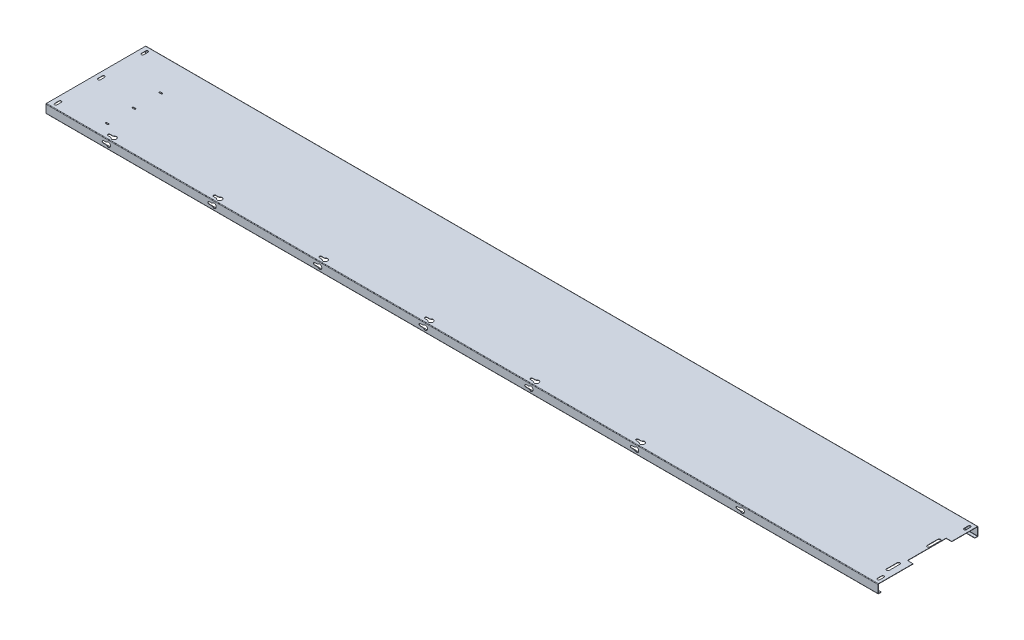
from build123d import *

# Parameters (mm, degrees)
SM_BASE_FLANGE_1_DEPTH = 3119
CUT_EXTRUDE_1_DEPTH    = 10
CUT_EXTRUDE_2_DEPTH    = 10
CUT_EXTRUDE_3_DEPTH    = 20
CUT_EXTRUDE_4_DEPTH    = 3140.834734504
CUT_EXTRUDE_6_DEPTH    = 3140.834734504
SKETCH_12_W            = 21
SKETCH_12_H            = 145
CUT_EXTRUDE_7_DEPTH    = 3140.834734504


# Sheet-metal steps are written as plain solids
with BuildPart() as part:
    # Sketch 1 → 基体-法兰1 (new body)
    with BuildSketch(Plane(origin=(0, 0, 0), x_dir=(0, 0, -1), z_dir=(1, 0, 0))):
        with BuildLine():
            Line((-3.4, -20.5), (-13.4634, -20.5))
            ThreePointArc((-13.4634, -20.5), (-14.832782992, -19.932782992), (-15.4, -18.5634))
            Line((-15.4, -18.5634), (-15.4, 10.5634))
            ThreePointArc((-15.4, 10.5634), (-14.832782992, 11.932782992), (-13.4634, 12.5))
            Line((-13.4634, 12.5), (357.6634, 12.5))
            ThreePointArc((357.6634, 12.5), (359.032782992, 11.932782992), (359.6, 10.5634))
            Line((359.6, 10.5634), (359.6, -18.5634))
            ThreePointArc((359.6, -18.5634), (359.032782992, -19.932782992), (357.6634, -20.5))
            Line((357.6634, -20.5), (347.6, -20.5))
            Line((347.6, -20.5), (347.6, -19.3))
            Line((347.6, -19.3), (357.6634, -19.3))
            ThreePointArc((357.6634, -19.3), (358.184254855, -19.084254855), (358.4, -18.5634))
            Line((358.4, -18.5634), (358.4, 10.5634))
            ThreePointArc((358.4, 10.5634), (358.184254855, 11.084254855), (357.6634, 11.3))
            Line((357.6634, 11.3), (-13.4634, 11.3))
            ThreePointArc((-13.4634, 11.3), (-13.984254855, 11.084254855), (-14.2, 10.5634))
            Line((-14.2, 10.5634), (-14.2, -18.5634))
            ThreePointArc((-14.2, -18.5634), (-13.984254855, -19.084254855), (-13.4634, -19.3))
            Line((-13.4634, -19.3), (-3.4, -19.3))
            Line((-3.4, -19.3), (-3.4, -20.5))
        make_face()
    extrude(amount=SM_BASE_FLANGE_1_DEPTH)

    # 草图6 → 切除-拉伸1 (cut)
    with BuildSketch(Plane(origin=(0, 12.5, 0), x_dir=(1, 0, 0), z_dir=(0, 1, 0))):
        with BuildLine():
            Line((3108.5, 180.1), (3108.5, 164.1))
            ThreePointArc((3108.5, 164.1), (3104, 159.6), (3099.5, 164.1))
            Line((3099.5, 164.1), (3099.5, 180.1))
            ThreePointArc((3099.5, 180.1), (3104, 184.6), (3108.5, 180.1))
        make_face()
        with BuildLine():
            Line((3108.5, 17.6), (3108.5, 1.6))
            ThreePointArc((3108.5, 1.6), (3104, -2.9), (3099.5, 1.6))
            Line((3099.5, 1.6), (3099.5, 17.6))
            ThreePointArc((3099.5, 17.6), (3104, 22.1), (3108.5, 17.6))
        make_face()
        with BuildLine():
            Line((3108.5, 342.6), (3108.5, 326.6))
            ThreePointArc((3108.5, 326.6), (3104, 322.1), (3099.5, 326.6))
            Line((3099.5, 326.6), (3099.5, 342.6))
            ThreePointArc((3099.5, 342.6), (3104, 347.1), (3108.5, 342.6))
        make_face()
        with BuildLine():
            Line((24.5, 17.6), (24.5, 1.6))
            ThreePointArc((24.5, 1.6), (20, -2.9), (15.5, 1.6))
            Line((15.5, 1.6), (15.5, 17.6))
            ThreePointArc((15.5, 17.6), (20, 22.1), (24.5, 17.6))
        make_face()
        with BuildLine():
            Line((24.5, 180.1), (24.5, 164.1))
            ThreePointArc((24.5, 164.1), (20, 159.6), (15.5, 164.1))
            Line((15.5, 164.1), (15.5, 180.1))
            ThreePointArc((15.5, 180.1), (20, 184.6), (24.5, 180.1))
        make_face()
        with BuildLine():
            Line((24.5, 342.6), (24.5, 326.6))
            ThreePointArc((24.5, 326.6), (20, 322.1), (15.5, 326.6))
            Line((15.5, 326.6), (15.5, 342.6))
            ThreePointArc((15.5, 342.6), (20, 347.1), (24.5, 342.6))
        make_face()
    extrude(amount=-CUT_EXTRUDE_1_DEPTH, mode=Mode.SUBTRACT)

    # 草图7 → 切除-拉伸2 (cut)
    with BuildSketch(Plane(origin=(0, 12.5, 0), x_dir=(1, 0, 0), z_dir=(0, 1, 0))):
        with BuildLine():
            Line((3096, 89.6), (3096, 49.6))
            ThreePointArc((3096, 49.6), (3091, 44.6), (3086, 49.6))
            Line((3086, 49.6), (3086, 89.6))
            ThreePointArc((3086, 89.6), (3091, 94.6), (3096, 89.6))
        make_face()
        with BuildLine():
            Line((3096, 242.1), (3096, 202.1))
            ThreePointArc((3096, 202.1), (3091, 197.1), (3086, 202.1))
            Line((3086, 202.1), (3086, 242.1))
            ThreePointArc((3086, 242.1), (3091, 247.1), (3096, 242.1))
        make_face()
    extrude(amount=-CUT_EXTRUDE_2_DEPTH, mode=Mode.SUBTRACT)

    # 草图8 → 切除-拉伸3 (cut)
    with BuildSketch(Plane.XY.offset(15.4)):
        with BuildLine():
            Line((215, -8.24999999), (225.066684168, -8.24999999))
            Line((225.066684168, -8.24999999), (233.286049958, -12.995453041))
            ThreePointArc((233.286049958, -12.995453041), (242, -3.999999989), (233.286049936, 4.995453042))
            Line((233.286049936, 4.995453042), (225.066684179, 0.25000001))
            Line((225.066684179, 0.25000001), (215, 0.25000001))
            ThreePointArc((215, 0.25000001), (210.75, -3.99999999), (215, -8.24999999))
        make_face()
        with BuildLine():
            Line((611, -8.24999999), (621.066684168, -8.24999999))
            Line((621.066684168, -8.24999999), (629.286049958, -12.995453041))
            ThreePointArc((629.286049958, -12.995453041), (638, -3.999999989), (629.286049936, 4.995453042))
            Line((629.286049936, 4.995453042), (621.066684179, 0.25000001))
            Line((621.066684179, 0.25000001), (611, 0.25000001))
            ThreePointArc((611, 0.25000001), (606.75, -3.99999999), (611, -8.24999999))
        make_face()
        with BuildLine():
            Line((1007, -8.24999999), (1017.066684168, -8.24999999))
            Line((1017.066684168, -8.24999999), (1025.286049958, -12.995453041))
            ThreePointArc((1025.286049958, -12.995453041), (1034, -3.999999989), (1025.286049936, 4.995453042))
            Line((1025.286049936, 4.995453042), (1017.066684179, 0.25000001))
            Line((1017.066684179, 0.25000001), (1007, 0.25000001))
            ThreePointArc((1007, 0.25000001), (1002.75, -3.99999999), (1007, -8.24999999))
        make_face()
        with BuildLine():
            Line((1403, -8.24999999), (1413.066684168, -8.24999999))
            Line((1413.066684168, -8.24999999), (1421.286049958, -12.995453041))
            ThreePointArc((1421.286049958, -12.995453041), (1430, -3.999999989), (1421.286049936, 4.995453042))
            Line((1421.286049936, 4.995453042), (1413.066684179, 0.25000001))
            Line((1413.066684179, 0.25000001), (1403, 0.25000001))
            ThreePointArc((1403, 0.25000001), (1398.75, -3.99999999), (1403, -8.24999999))
        make_face()
        with BuildLine():
            Line((1799, -8.24999999), (1809.066684168, -8.24999999))
            Line((1809.066684168, -8.24999999), (1817.286049958, -12.995453041))
            ThreePointArc((1817.286049958, -12.995453041), (1826, -3.999999989), (1817.286049936, 4.995453042))
            Line((1817.286049936, 4.995453042), (1809.066684179, 0.25000001))
            Line((1809.066684179, 0.25000001), (1799, 0.25000001))
            ThreePointArc((1799, 0.25000001), (1794.75, -3.99999999), (1799, -8.24999999))
        make_face()
        with BuildLine():
            Line((2195, -8.24999999), (2205.066684168, -8.24999999))
            Line((2205.066684168, -8.24999999), (2213.286049958, -12.995453041))
            ThreePointArc((2213.286049958, -12.995453041), (2222, -3.999999989), (2213.286049936, 4.995453042))
            Line((2213.286049936, 4.995453042), (2205.066684179, 0.25000001))
            Line((2205.066684179, 0.25000001), (2195, 0.25000001))
            ThreePointArc((2195, 0.25000001), (2190.75, -3.99999999), (2195, -8.24999999))
        make_face()
        with BuildLine():
            Line((2591, -8.24999999), (2601.066684168, -8.24999999))
            Line((2601.066684168, -8.24999999), (2609.286049958, -12.995453041))
            ThreePointArc((2609.286049958, -12.995453041), (2618, -3.999999989), (2609.286049936, 4.995453042))
            Line((2609.286049936, 4.995453042), (2601.066684179, 0.25000001))
            Line((2601.066684179, 0.25000001), (2591, 0.25000001))
            ThreePointArc((2591, 0.25000001), (2586.75, -3.99999999), (2591, -8.24999999))
        make_face()
    extrude(amount=-CUT_EXTRUDE_3_DEPTH, mode=Mode.SUBTRACT)

    # 草图9 → 切除-拉伸4 (cut, through all)
    with BuildSketch(Plane(origin=(0, 12.5, 0), x_dir=(1, 0, 0), z_dir=(0, 1, 0))):
        with BuildLine():
            Line((220, -3.15), (229.772758664, -3.15))
            Line((229.772758664, -3.15), (238, -7.9))
            ThreePointArc((238, -7.9), (247, 1.1), (238, 10.1))
            Line((238, 10.1), (229.772758664, 5.35))
            Line((229.772758664, 5.35), (220, 5.35))
            ThreePointArc((220, 5.35), (215.75, 1.1), (220, -3.15))
        make_face()
        with BuildLine():
            Line((616, -3.15), (625.772758664, -3.15))
            Line((625.772758664, -3.15), (634, -7.9))
            ThreePointArc((634, -7.9), (643, 1.1), (634, 10.1))
            Line((634, 10.1), (625.772758664, 5.35))
            Line((625.772758664, 5.35), (616, 5.35))
            ThreePointArc((616, 5.35), (611.75, 1.1), (616, -3.15))
        make_face()
        with BuildLine():
            Line((1012, -3.15), (1021.772758664, -3.15))
            Line((1021.772758664, -3.15), (1030, -7.9))
            ThreePointArc((1030, -7.9), (1039, 1.1), (1030, 10.1))
            Line((1030, 10.1), (1021.772758664, 5.35))
            Line((1021.772758664, 5.35), (1012, 5.35))
            ThreePointArc((1012, 5.35), (1007.75, 1.1), (1012, -3.15))
        make_face()
        with BuildLine():
            Line((1408, -3.15), (1417.772758664, -3.15))
            Line((1417.772758664, -3.15), (1426, -7.9))
            ThreePointArc((1426, -7.9), (1435, 1.1), (1426, 10.1))
            Line((1426, 10.1), (1417.772758664, 5.35))
            Line((1417.772758664, 5.35), (1408, 5.35))
            ThreePointArc((1408, 5.35), (1403.75, 1.1), (1408, -3.15))
        make_face()
        with BuildLine():
            Line((1804, -3.15), (1813.772758664, -3.15))
            Line((1813.772758664, -3.15), (1822, -7.9))
            ThreePointArc((1822, -7.9), (1831, 1.1), (1822, 10.1))
            Line((1822, 10.1), (1813.772758664, 5.35))
            Line((1813.772758664, 5.35), (1804, 5.35))
            ThreePointArc((1804, 5.35), (1799.75, 1.1), (1804, -3.15))
        make_face()
        with BuildLine():
            Line((2200, -3.15), (2209.772758664, -3.15))
            Line((2209.772758664, -3.15), (2218, -7.9))
            ThreePointArc((2218, -7.9), (2227, 1.1), (2218, 10.1))
            Line((2218, 10.1), (2209.772758664, 5.35))
            Line((2209.772758664, 5.35), (2200, 5.35))
            ThreePointArc((2200, 5.35), (2195.75, 1.1), (2200, -3.15))
        make_face()
    extrude(amount=-CUT_EXTRUDE_4_DEPTH, mode=Mode.SUBTRACT)

    # 草图11 → 切除-拉伸6 (cut, through all)
    with BuildSketch(Plane(origin=(0, 12.5, 0), x_dir=(1, 0, 0), z_dir=(0, 1, 0))):
        with BuildLine():
            Line((176.5, 37.1), (183.5, 37.1))
            ThreePointArc((183.5, 37.1), (186, 34.6), (183.5, 32.1))
            Line((183.5, 32.1), (176.5, 32.1))
            ThreePointArc((176.5, 32.1), (174, 34.6), (176.5, 37.1))
        make_face()
        with BuildLine():
            Line((176.5, 137.1), (183.5, 137.1))
            ThreePointArc((183.5, 137.1), (186, 134.6), (183.5, 132.1))
            Line((183.5, 132.1), (176.5, 132.1))
            ThreePointArc((176.5, 132.1), (174, 134.6), (176.5, 137.1))
        make_face()
        with BuildLine():
            Line((176.5, 237.1), (183.5, 237.1))
            ThreePointArc((183.5, 237.1), (186, 234.6), (183.5, 232.1))
            Line((183.5, 232.1), (176.5, 232.1))
            ThreePointArc((176.5, 232.1), (174, 234.6), (176.5, 237.1))
        make_face()
    extrude(amount=-CUT_EXTRUDE_6_DEPTH, mode=Mode.SUBTRACT)

    # 草图12 → 切除-拉伸7 (cut, through all)
    with BuildSketch(Plane(origin=(0, 12.5, 0), x_dir=(1, 0, 0), z_dir=(0, 1, 0))):
        with Locations((3108.5, 188.6)):
            Rectangle(SKETCH_12_W, SKETCH_12_H)
    extrude(amount=-CUT_EXTRUDE_7_DEPTH, mode=Mode.SUBTRACT)


solid = part.part
